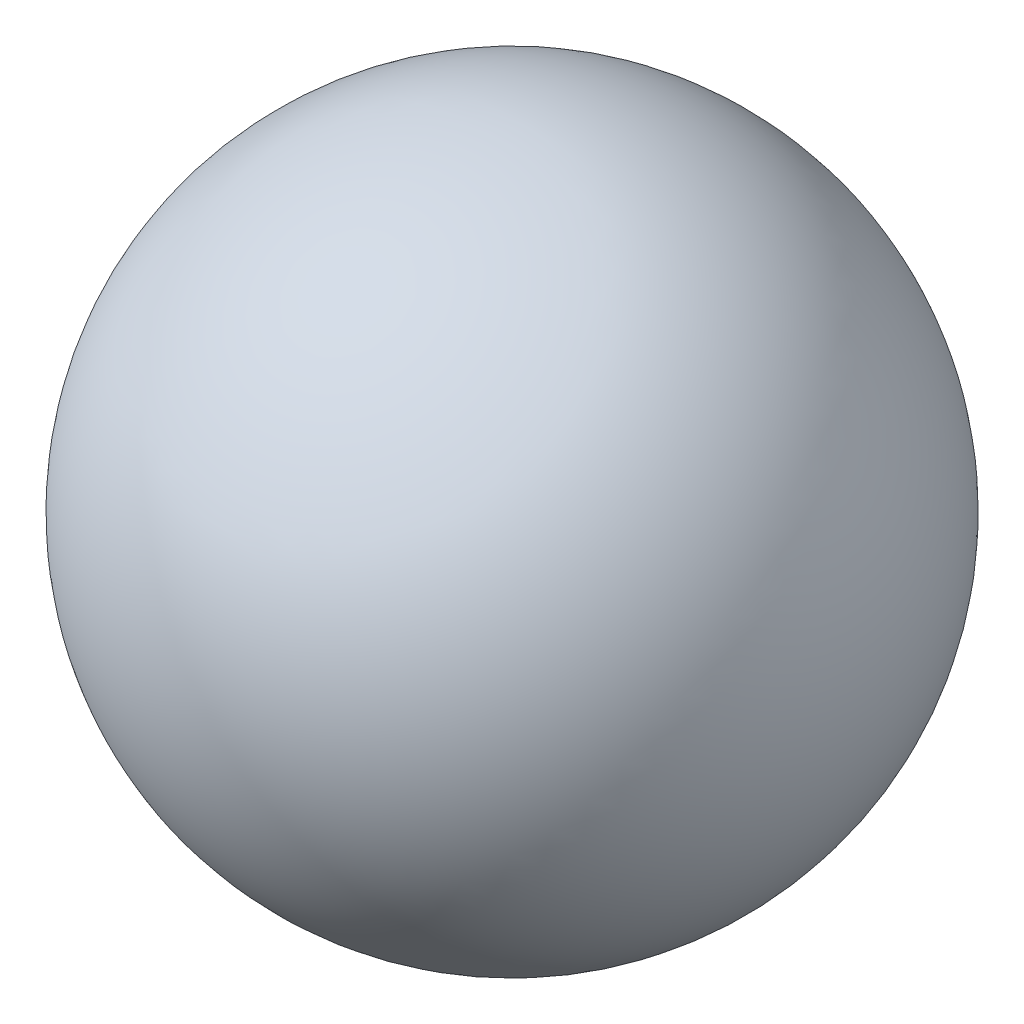
from build123d import *


with BuildPart() as part:
    # Sketch2 → Revolve1 (revolve)
    with BuildSketch(Plane.YZ):
        with BuildLine():
            Line((0, -15), (0, 15))
            ThreePointArc((0, 15), (15, 0), (0, -15))
        make_face()
    revolve(axis=Axis((0, 0, -15), (0, 0, 1)))


solid = part.part
